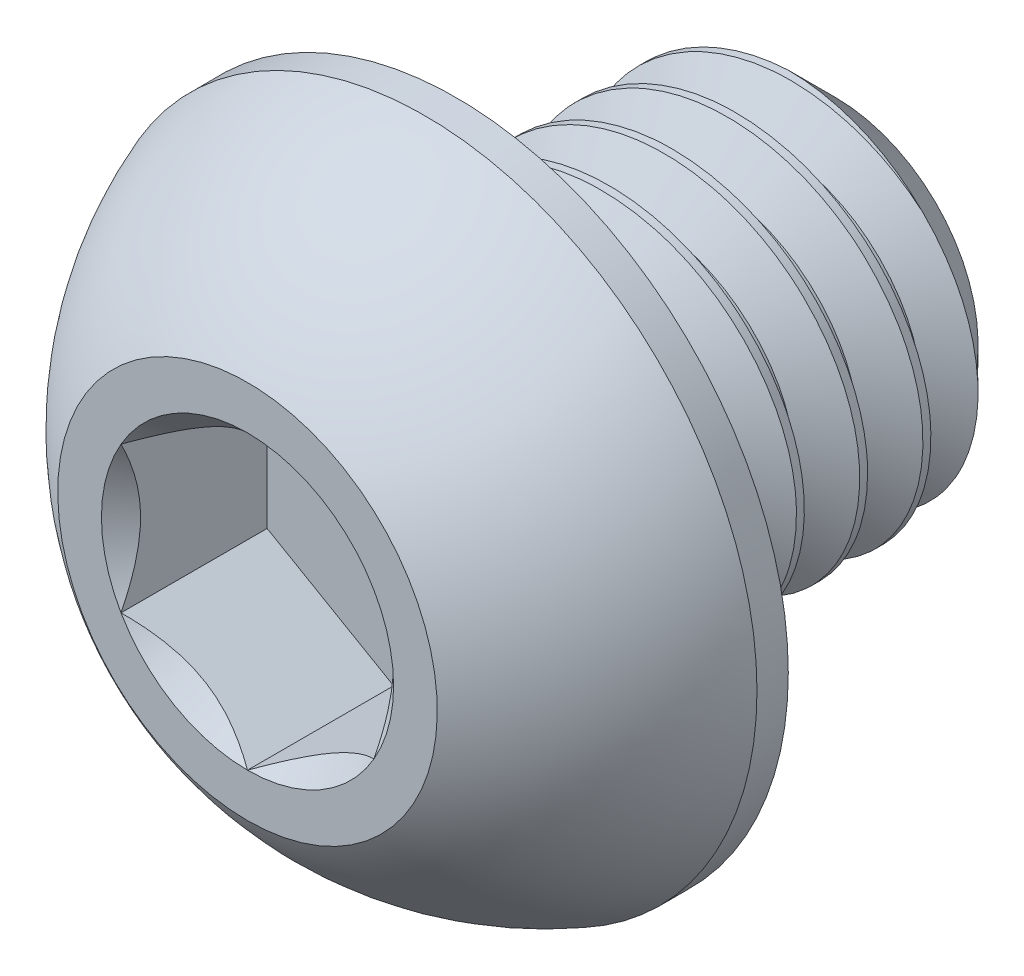
from build123d import *

# Parameters (mm, degrees)
SKETCH1_W          = 6
SKETCH1_H          = 3
CHAMFER1_SIZE      = 0.75
CUT_EXTRUDE2_DEPTH = 2.31
CUT_SWEEP1_PITCH   = 1


with BuildPart() as part:
    # Sketch1 → Revolve1 (revolve)
    with BuildSketch(Plane(origin=(0, 0, 0), x_dir=(0, 0, -1), z_dir=(1, 0, 0))):
        with Locations((6.3, 1.5)):
            Rectangle(SKETCH1_W, SKETCH1_H)
    revolve(axis=Axis((0, 0, -9.3), (0, 0, 1)))

    # Chamfer1
    chamfer1_edges = [part.edges().sort_by_distance(p)[0] for p in [
        (0, -3, -9.3),
    ]]
    chamfer(chamfer1_edges, length=CHAMFER1_SIZE)

    # Sketch7 → Revolve2 (revolve)
    with BuildSketch(Plane(origin=(0, 0, 0), x_dir=(0, 0, -1), z_dir=(1, 0, 0)), mode=Mode.PRIVATE) as revolve2_sk:
        with BuildLine():
            Line((2.805, 5.25), (3.3, 5.25))
            Line((3.3, 5.25), (3.3, 0))
            Line((3.3, 0), (0, 0))
            Line((0, 0), (0, 3))
            ThreePointArc((0, 3), (1.216479019, 4.356906156), (2.805, 5.25))
        make_face()
    revolve(revolve2_sk.sketch.rotate(Axis((0, 0, 0), (0, 0, -1)), 180), axis=Axis((0, 0, 0), (0, 0, -1)))

    # Sketch5 → Cut-Extrude2 (cut)
    with BuildSketch(Plane.XY):
        Polygon((2, -1.154700538), (2, 1.154700538), (0, 2.309401077), (-2, 1.154700538), (-2, -1.154700538), (0, -2.309401077), align=None)
    extrude(amount=-CUT_EXTRUDE2_DEPTH, mode=Mode.SUBTRACT)

    # Cut-Extrude3 cone 1 section (through the dimple's axis) → Cut-Extrude3 (revolve, cut)
    with BuildSketch(Plane(origin=(0, 0, 0), x_dir=(0, -1, 0), z_dir=(1, 0, 0))):
        Polygon((0, 0), (2.309401077, 0), (0, 2.309401077), align=None)
    revolve(axis=Axis((0, 0, 0), (0, 0, -1)), mode=Mode.SUBTRACT)

    # Cut-Sweep1: the profile of Sketch2 profile screwed along a right-hand helix of 7 turns, 8 arcs to a turn; built about Z, then put on its axis
    cut_sweep1_z = Axis((0, 0, 0), (0, 0, 1))
    cut_sweep1_corners = [(3.0003, 0, 0.750173205), (3.0003, 0, -0.125173205), (2.350480947, 0, 0.25), (2.350480947, 0, 0.375)]
    with BuildLine(mode=Mode.PRIVATE) as cut_sweep1_profile:
        Line(cut_sweep1_corners[0], cut_sweep1_corners[1])
        Line(cut_sweep1_corners[1], cut_sweep1_corners[2])
        Line(cut_sweep1_corners[2], cut_sweep1_corners[3])
        Line(cut_sweep1_corners[3], cut_sweep1_corners[0])
    cut_sweep1_cap = Face(cut_sweep1_profile.wire())
    cut_sweep1_turn_angles = [0, 22.5, 45, 67.5, 90, 112.5, 135, 157.5, 180, 202.5, 225, 247.5, 270, 292.5, 315, 337.5, 360]
    cut_sweep1_turn_weights = [1, 0.9238795325112867, 1, 0.9238795325112867, 1, 0.9238795325112867, 1, 0.9238795325112867, 1, 0.9238795325112867, 1, 0.9238795325112867, 1, 0.9238795325112867, 1, 0.9238795325112867, 1]
    cut_sweep1_turn_rails = [Edge.make_bspline([Vector(p[0], p[1], 0).rotate(cut_sweep1_z, cut_sweep1_turn_angles[k]) / cut_sweep1_turn_weights[k] + Vector(0, 0, p[2] + CUT_SWEEP1_PITCH * cut_sweep1_turn_angles[k] / 360) for k in range(17)], [0, 0, 0, 1, 1, 2, 2, 3, 3, 4, 4, 5, 5, 6, 6, 7, 7, 8, 8, 8], 2, cut_sweep1_turn_weights) for p in cut_sweep1_corners]
    cut_sweep1_turn_sides = [Face.make_surface_from_curves(cut_sweep1_turn_rails[p[0]], cut_sweep1_turn_rails[p[1]]) for p in [(0, 1), (1, 2), (2, 3), (3, 0)]]
    cut_sweep1 = Plane(origin=(0, 0, -9.3), x_dir=(0, 1, 0), z_dir=(0, 0, 1)) * Solid(Shell([*[p.moved(Location((0, 0, CUT_SWEEP1_PITCH * i))) for i in range(7) for p in cut_sweep1_turn_sides], cut_sweep1_cap, cut_sweep1_cap.rotate(cut_sweep1_z, 2520).moved(Location((0, 0, CUT_SWEEP1_PITCH * 2520 / 360)))]))
    add(cut_sweep1, mode=Mode.SUBTRACT)


solid = part.part
